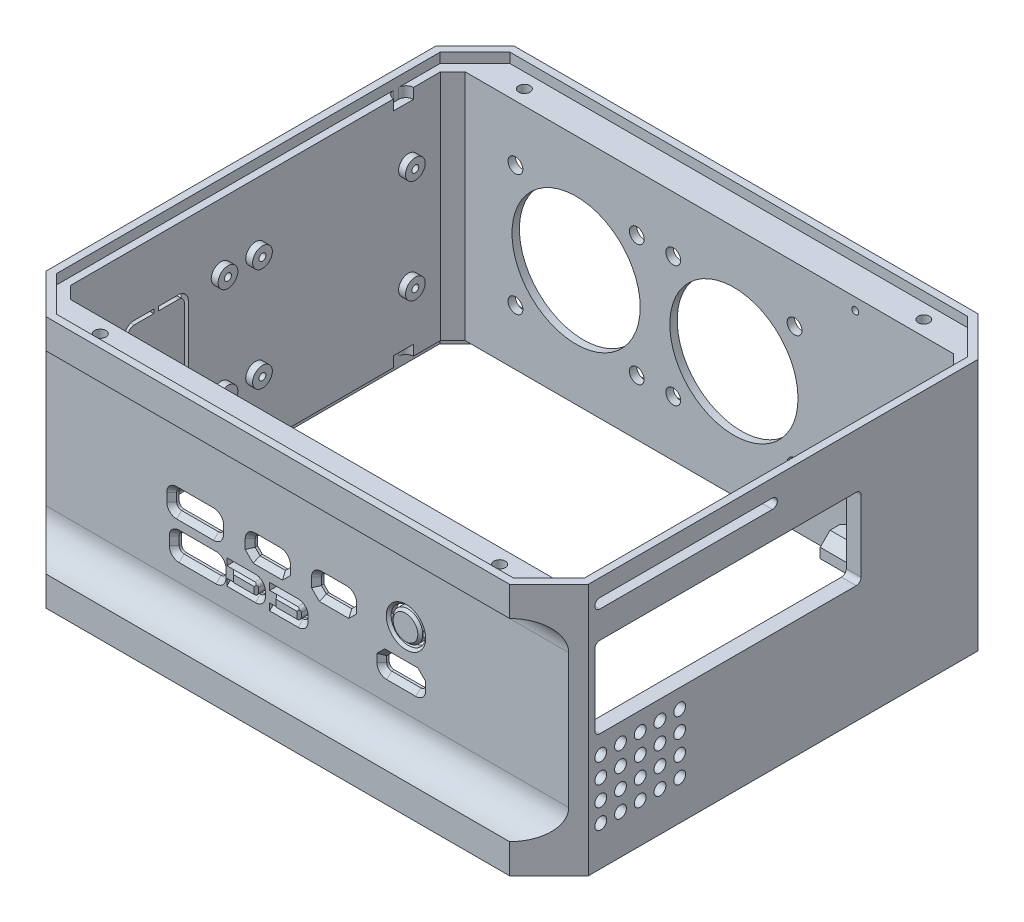
from build123d import *

# Parameters (mm, degrees)
SKETCH_1_W                = 110
SKETCH_1_H                = 95
EXTRUDE_1_DEPTH           = 47.2
CHAMFER_1_SIZE            = 8
CUT_EXTRUDE_1_DEPTH       = 95.258791408
EXTRUDE_2_DEPTH           = 2
EXTRUDE_3_DEPTH           = 2
SKETCH_5_W                = 6
SKETCH_5_H                = 39.2
CUT_EXTRUDE_2_DEPTH       = 130.823451574
SKETCH_7_W                = 6
SKETCH_7_H                = 39.2
CUT_EXTRUDE_3_DEPTH       = 130.823451574
FILLET_1_R                = 6
CUT_EXTRUDE_5_REACH       = 131.823
CUT_EXTRUDE_8_REACH       = 123.099
SKETCH_10_R               = 3.5
SKETCH_10_W               = 7.15
SKETCH_10_H               = 3.5
SKETCH_10_W_2             = 9.5
SKETCH_10_H_2             = 3.7
SKETCH_10_W_3             = 6.8
SKETCH_10_H_3             = 3
SKETCH_10_W_4             = 7.9
SKETCH_10_H_4             = 3.2
FILLET_2_R                = 1
CHAMFER_2_SIZE            = 1
SKETCH_15_W               = 6.4
SKETCH_15_H               = 2.2
EXTRUDE_4_DEPTH           = 2
SKETCH_17_W               = 5
SKETCH_17_H               = 2.2
EXTRUDE_5_DEPTH           = 0.5
EXTRUDE_5_DRAFT           = 39
EXTRUDE_5_PROFILE_2_DEPTH = 0.5
EXTRUDE_5_PROFILE_2_DRAFT = 39
FILLET_3_R                = 0.7
FILLET_4_R                = 1
CHAMFER_3_SIZE            = 1
SKETCH_18_R               = 1.15
CUT_EXTRUDE_9_DEPTH       = 3.5
CUT_EXTRUDE_START         = -3.5
SKETCH_19_R               = 1.15
CUT_EXTRUDE_10_DEPTH      = 3.5
SKETCH_20_R               = 13
SKETCH_20_R_2             = 1.5
CUT_EXTRUDE_11_DEPTH      = 121.001171574
SKETCH_22_W               = 62
SKETCH_22_H               = 39.2
CUT_EXTRUDE_12_DEPTH      = 122.099261679
EXTRUDE_6_DEPTH           = 3
EXTRUDE_6_DEPTH_BACK      = 3
CHAMFER_5_SIZE            = 2
CUT_EXTRUDE_15_REACH      = 131.823
SKETCH_26_R               = 1.2
SKETCH_27_W               = 13
SKETCH_27_H               = 22
CUT_EXTRUDE_16_DEPTH      = 10
FILLET_5_R                = 2
CHAMFER_6_SIZE            = 1.5
CUT_EXTRUDE_START_2       = -0.5
CUT_EXTRUDE_17_DEPTH      = 0.5
SKETCH_30_W               = 37
SKETCH_30_H               = 2
CUT_EXTRUDE_18_DEPTH      = 10
FILLET_6_R                = 1
SKETCH_31_R               = 2
EXTRUDE_7_DEPTH           = 1.4
SKETCH_32_R               = 0.7
CUT_EXTRUDE_19_DEPTH      = 3.5
SKETCH_39_R               = 3
EXTRUDE_12_DEPTH          = 1.6
CHAMFER_7_SIZE            = 0.5
SKETCH_40_W               = 10
SKETCH_40_H               = 1
EXTRUDE_13_DEPTH          = 1
CHAMFER_8_SIZE            = 0.5
EXTRUDE_14_DEPTH          = 1.2
SKETCH_42_W               = 1
SKETCH_42_H               = 24
EXTRUDE_15_DEPTH          = 1.2
SKETCH_43_R               = 2
EXTRUDE_16_DEPTH          = 1.4
SKETCH_44_R               = 0.7
CUT_EXTRUDE_20_DEPTH      = 3.5
SKETCH_45_W               = 1.5
SKETCH_45_H               = 4
CUT_EXTRUDE_21_DEPTH      = 2.1
FILLET_7_R                = 1.5
CUT_EXTRUDE_22_DEPTH      = 2.1
SKETCH_47_R               = 0.7
CUT_EXTRUDE_23_DEPTH      = 3


# Read off the part's stored shape, not the designer's step: 切除-拉伸17
# Some blends are built 0.0001 mm under size
with BuildPart() as part:
    # 草图1 → 凸台-拉伸1 (new body)
    with BuildSketch(Plane(origin=(0, 0, 0), x_dir=(1, 0, 0), z_dir=(0, 1, 0))):
        with Locations((10.752499413, 0.806196069)):
            Rectangle(SKETCH_1_W, SKETCH_1_H)
    extrude(amount=EXTRUDE_1_DEPTH)

    # 倒角1
    chamfer_1_edges = [part.edges().sort_by_distance(p)[0] for p in [
        (-44.247500587, 23.6, -48.306196069),
        (65.752499413, 23.6, -48.306196069),
        (65.752499413, 23.6, 46.693803931),
        (-44.247500587, 23.6, 46.693803931),
    ]]
    chamfer(chamfer_1_edges, length=CHAMFER_1_SIZE)

    # 草图2 → 切除-拉伸1 (cut, through all)
    with BuildSketch(Plane.XZ):
        Polygon((-38.747500587, 39.193803931), (60.252499413, 39.193803931), (62.752499413, 36.693803931), (62.752499413, -38.306196069), (60.252499413, -40.806196069), (-38.747500587, -40.806196069), (-41.247500587, -38.306196069), (-41.247500587, 36.693803931), align=None)
    extrude(amount=-CUT_EXTRUDE_1_DEPTH, mode=Mode.SUBTRACT)

    # 草图3 → 凸台-拉伸2 (add)
    with BuildSketch(Plane.XZ):
        Polygon((-44.247500587, -40.306196069), (-36.247500587, -48.306196069), (57.752499413, -48.306196069), (65.752499413, -40.306196069), (65.752499413, 38.693803931), (57.752499413, 46.693803931), (-36.247500587, 46.693803931), (-44.247500587, 38.693803931), align=None)
        Polygon((-42.747500587, -39.684875725), (-35.626180243, -46.806196069), (57.13117907, -46.806196069), (64.252499413, -39.684875725), (64.252499413, 38.072483588), (57.13117907, 45.193803931), (-35.626180243, 45.193803931), (-42.747500587, 38.072483588), align=None, mode=Mode.SUBTRACT)
    extrude(amount=EXTRUDE_2_DEPTH)

    # 草图4 → 凸台-拉伸3 (add)
    with BuildSketch(Plane(origin=(0, 47.2, 0), x_dir=(1, 0, 0), z_dir=(0, 1, 0))):
        Polygon((-36.247500587, 48.306196069), (-44.247500587, 40.306196069), (-44.247500587, -38.693803931), (-36.247500587, -46.693803931), (57.752499413, -46.693803931), (65.752499413, -38.693803931), (65.752499413, 40.306196069), (57.752499413, 48.306196069), align=None)
        Polygon((-35.626180243, 46.806196069), (-42.747500587, 39.684875725), (-42.747500587, -38.072483588), (-35.626180243, -45.193803931), (57.13117907, -45.193803931), (64.252499413, -38.072483588), (64.252499413, 39.684875725), (57.13117907, 46.806196069), align=None, mode=Mode.SUBTRACT)
    extrude(amount=EXTRUDE_3_DEPTH)

    # 草图5 → 切除-拉伸2 (cut, through all)
    with BuildSketch(Plane(origin=(65.752499413, 0, 0), x_dir=(0, 0, -1), z_dir=(1, 0, 0))):
        with Locations((-43.693803931, 23.6)):
            Rectangle(SKETCH_5_W, SKETCH_5_H)
    extrude(amount=-CUT_EXTRUDE_2_DEPTH, mode=Mode.SUBTRACT)

    # 草图7 → 切除-拉伸3 (cut, through all)
    with BuildSketch(Plane(origin=(65.752499413, 0, 0), x_dir=(0, 0, -1), z_dir=(1, 0, 0))):
        with Locations((45.306196069, 23.6)):
            Rectangle(SKETCH_7_W, SKETCH_7_H)
    extrude(amount=-CUT_EXTRUDE_3_DEPTH, mode=Mode.SUBTRACT)

    # 圆角1
    fillet_1_edges = [part.edges().sort_by_distance(p)[0] for p in [
        (10.752499413, 43.2, -42.306196069),
        (10.752499413, 4, -42.306196069),
        (10.752499413, 43.2, 40.693803931),
        (10.752499413, 4, 40.693803931),
    ]]
    fillet(fillet_1_edges, radius=FILLET_1_R - 0.0001)  # a hair under: the kernel refuses the full size

    # 草图9 → 切除-拉伸5 (cut, up to next)
    with BuildSketch(Plane(origin=(65.752499413, 0, 0), x_dir=(0, 0, -1), z_dir=(1, 0, 0)), mode=Mode.PRIVATE) as cut_extrude_5_sk1:
        with BuildLine():
            Line((15.606196069, 38.2), (-36.393803931, 38.2))
            ThreePointArc((-36.393803931, 38.2), (-37.100910712, 37.907106781), (-37.393803931, 37.2))
            Line((-37.393803931, 37.2), (-37.393803931, 22.8))
            ThreePointArc((-37.393803931, 22.8), (-37.100910712, 22.092893219), (-36.393803931, 21.8))
            Line((-36.393803931, 21.8), (15.606196069, 21.8))
            ThreePointArc((15.606196069, 21.8), (16.31330285, 22.092893219), (16.606196069, 22.8))
            Line((16.606196069, 22.8), (16.606196069, 37.2))
            ThreePointArc((16.606196069, 37.2), (16.31330285, 37.907106781), (15.606196069, 38.2))
        make_face()
    cut_extrude_5_tool1 = extrude(cut_extrude_5_sk1.sketch, amount=-CUT_EXTRUDE_5_REACH, mode=Mode.PRIVATE) & part.part
    add(cut_extrude_5_tool1.solids().sort_by_distance((65.752499, 30, 10.393804))[0], mode=Mode.SUBTRACT)

    # 草图10 → 切除-拉伸8 (cut, up to next)
    with BuildSketch(Plane.XY.offset(40.693803931), mode=Mode.PRIVATE) as cut_extrude_8_sk1:
        with Locations((30.752499413, 25.19)):
            Circle(SKETCH_10_R)
    cut_extrude_8_tool1 = extrude(cut_extrude_8_sk1.sketch, amount=-CUT_EXTRUDE_8_REACH, mode=Mode.PRIVATE) & part.part
    # 草图10 → 切除-拉伸8 (cut, up to next)
    with BuildSketch(Plane.XY.offset(40.693803931), mode=Mode.PRIVATE) as cut_extrude_8_sk2:
        with Locations((16.177499413, 23.66)):
            Rectangle(SKETCH_10_W, SKETCH_10_H)
    cut_extrude_8_tool2 = extrude(cut_extrude_8_sk2.sketch, amount=-CUT_EXTRUDE_8_REACH, mode=Mode.PRIVATE) & part.part
    # 草图10 → 切除-拉伸8 (cut, up to next)
    with BuildSketch(Plane.XY.offset(40.693803931), mode=Mode.PRIVATE) as cut_extrude_8_sk3:
        with Locations((2.727499413, 23.66)):
            Rectangle(SKETCH_10_W, SKETCH_10_H)
    cut_extrude_8_tool3 = extrude(cut_extrude_8_sk3.sketch, amount=-CUT_EXTRUDE_8_REACH, mode=Mode.PRIVATE) & part.part
    # 草图10 → 切除-拉伸8 (cut, up to next)
    with BuildSketch(Plane.XY.offset(40.693803931), mode=Mode.PRIVATE) as cut_extrude_8_sk4:
        with Locations((-11.997500587, 23.76)):
            Rectangle(SKETCH_10_W_2, SKETCH_10_H_2)
    cut_extrude_8_tool4 = extrude(cut_extrude_8_sk4.sketch, amount=-CUT_EXTRUDE_8_REACH, mode=Mode.PRIVATE) & part.part
    # 草图10 → 切除-拉伸8 (cut, up to next)
    with BuildSketch(Plane.XY.offset(40.693803931), mode=Mode.PRIVATE) as cut_extrude_8_sk5:
        with Locations((-11.497500587, 16.36)):
            Rectangle(SKETCH_10_W_2, SKETCH_10_H_2)
    cut_extrude_8_tool5 = extrude(cut_extrude_8_sk5.sketch, amount=-CUT_EXTRUDE_8_REACH, mode=Mode.PRIVATE) & part.part
    # 草图10 → 切除-拉伸8 (cut, up to next)
    with BuildSketch(Plane.XY.offset(40.693803931), mode=Mode.PRIVATE) as cut_extrude_8_sk6:
        with Locations((-2.159249242, 16.71)):
            Rectangle(SKETCH_10_W_3, SKETCH_10_H_3)
    cut_extrude_8_tool6 = extrude(cut_extrude_8_sk6.sketch, amount=-CUT_EXTRUDE_8_REACH, mode=Mode.PRIVATE) & part.part
    # 草图10 → 切除-拉伸8 (cut, up to next)
    with BuildSketch(Plane.XY.offset(40.693803931), mode=Mode.PRIVATE) as cut_extrude_8_sk7:
        with Locations((6.518865381, 16.71)):
            Rectangle(SKETCH_10_W_3, SKETCH_10_H_3)
    cut_extrude_8_tool7 = extrude(cut_extrude_8_sk7.sketch, amount=-CUT_EXTRUDE_8_REACH, mode=Mode.PRIVATE) & part.part
    # 草图10 → 切除-拉伸8 (cut, up to next)
    with BuildSketch(Plane.XY.offset(40.693803931), mode=Mode.PRIVATE) as cut_extrude_8_sk8:
        with Locations((29.802499413, 16.61)):
            Rectangle(SKETCH_10_W_4, SKETCH_10_H_4)
    cut_extrude_8_tool8 = extrude(cut_extrude_8_sk8.sketch, amount=-CUT_EXTRUDE_8_REACH, mode=Mode.PRIVATE) & part.part
    add(cut_extrude_8_tool1.solids().sort_by_distance((30.752499, 25.19, 40.693804))[0], mode=Mode.SUBTRACT)
    add(cut_extrude_8_tool2.solids().sort_by_distance((16.177499, 23.66, 40.693804))[0], mode=Mode.SUBTRACT)
    add(cut_extrude_8_tool3.solids().sort_by_distance((2.727499, 23.66, 40.693804))[0], mode=Mode.SUBTRACT)
    add(cut_extrude_8_tool4.solids().sort_by_distance((-11.997501, 23.76, 40.693804))[0], mode=Mode.SUBTRACT)
    add(cut_extrude_8_tool5.solids().sort_by_distance((-11.497501, 16.36, 40.693804))[0], mode=Mode.SUBTRACT)
    add(cut_extrude_8_tool6.solids().sort_by_distance((-2.159249, 16.71, 40.693804))[0], mode=Mode.SUBTRACT)
    add(cut_extrude_8_tool7.solids().sort_by_distance((6.518865, 16.71, 40.693804))[0], mode=Mode.SUBTRACT)
    add(cut_extrude_8_tool8.solids().sort_by_distance((29.802499, 16.61, 40.693804))[0], mode=Mode.SUBTRACT)

    # 圆角2
    fillet_2_edges = [part.edges().sort_by_distance(p)[0] for p in [
        (12.602499413, 25.41, 39.943803931),
        (19.752499413, 25.41, 39.943803931),
        (-0.847500587, 25.41, 39.943803931),
        (6.302499413, 25.41, 39.943803931),
        (-16.747500587, 21.91, 39.943803931),
        (-16.747500587, 25.61, 39.943803931),
        (-7.247500587, 25.61, 39.943803931),
        (-7.247500587, 21.91, 39.943803931),
        (-16.247500587, 14.51, 39.943803931),
        (-16.247500587, 18.21, 39.943803931),
        (-6.747500587, 18.21, 39.943803931),
        (-6.747500587, 14.51, 39.943803931),
        (25.852499413, 15.01, 39.943803931),
        (33.752499413, 15.01, 39.943803931),
    ]]
    fillet(fillet_2_edges, radius=FILLET_2_R)

    # 倒角2
    chamfer_2_edges = [part.edges().sort_by_distance(p)[0] for p in [
        (12.602499413, 21.91, 39.943803931),
        (19.752499413, 21.91, 39.943803931),
        (-0.847500587, 21.91, 39.943803931),
        (6.302499413, 21.91, 39.943803931),
        (25.852499413, 18.21, 39.943803931),
        (33.752499413, 18.21, 39.943803931),
    ]]
    chamfer(chamfer_2_edges, length=CHAMFER_2_SIZE)

    # 草图15 → 凸台-拉伸4 (add)
    with BuildSketch(Plane.XY.offset(40.693803931)):
        with Locations((-2.359249242, 16.71)):
            Rectangle(SKETCH_15_W, SKETCH_15_H)
        with Locations((6.318865381, 16.71)):
            Rectangle(SKETCH_15_W, SKETCH_15_H)
    extrude(amount=-EXTRUDE_4_DEPTH)


with BuildPart() as extrude_5_tool:
    # 草图17 → 凸台-拉伸5 (with draft: the straight prism first)
    with BuildSketch(Plane.XY.offset(40.693803931)):
        with Locations((-1.659249242, 16.71)):
            Rectangle(SKETCH_17_W, SKETCH_17_H)
    extrude(amount=EXTRUDE_5_DEPTH)
    # 凸台-拉伸5: the draft: its side faces are tilted about the plane it starts from
    extrude_5_sides = [extrude_5_tool.faces().sort_by_distance(p)[0] for p in [
        (-1.659249242, 17.81, 40.943803931),
        (-4.159249242, 16.71, 40.943803931),
        (-1.659249242, 15.61, 40.943803931),
        (0.840750758, 16.71, 40.943803931),
    ]]
    draft(extrude_5_sides, Plane.XY.offset(40.693803931), EXTRUDE_5_DRAFT)


with BuildPart() as part_1:
    add(part.part)

    # 凸台-拉伸5: add extrude_5_tool
    add(extrude_5_tool.part)


with BuildPart() as extrude_5_profile_2_tool:
    # 草图17 → 凸台-拉伸5 profile 2 (with draft: the straight prism first)
    with BuildSketch(Plane.XY.offset(40.693803931)):
        with Locations((7.018865381, 16.71)):
            Rectangle(SKETCH_17_W, SKETCH_17_H)
    extrude(amount=EXTRUDE_5_PROFILE_2_DEPTH)
    # 凸台-拉伸5 profile 2: the draft: its side faces are tilted about the plane it starts from
    extrude_5_profile_2_sides = [extrude_5_profile_2_tool.faces().sort_by_distance(p)[0] for p in [
        (7.018865381, 17.81, 40.943803931),
        (4.518865381, 16.71, 40.943803931),
        (7.018865381, 15.61, 40.943803931),
        (9.518865381, 16.71, 40.943803931),
    ]]
    draft(extrude_5_profile_2_sides, Plane.XY.offset(40.693803931), EXTRUDE_5_PROFILE_2_DRAFT)


with BuildPart() as part_2:
    add(part_1.part)

    # 凸台-拉伸5 profile 2: add extrude_5_profile_2_tool
    add(extrude_5_profile_2_tool.part)

    # 圆角3
    fillet_3_edges = [part_2.edges().sort_by_distance(p)[0] for p in [
        (0.840750758, 17.81, 39.693803931),
        (0.840750758, 15.61, 39.693803931),
        (9.518865381, 17.81, 39.693803931),
        (9.518865381, 15.61, 39.693803931),
    ]]
    fillet(fillet_3_edges, radius=FILLET_3_R)

    # 圆角4
    fillet_4_edges = [part_2.edges().sort_by_distance(p)[0] for p in [
        (1.240750758, 18.21, 39.943803931),
        (1.240750758, 15.21, 39.943803931),
        (9.918865381, 18.21, 39.943803931),
        (9.918865381, 15.21, 39.943803931),
    ]]
    fillet(fillet_4_edges, radius=FILLET_4_R)

    # 倒角3
    chamfer_3_edges = [part_2.edges().sort_by_distance(p)[0] for p in [
        (-2.659249242, 15.21, 40.693803931),
        (6.018865381, 15.21, 40.693803931),
        (-0.847500587, 23.66, 40.693803931),
        (2.727499413, 25.41, 40.693803931),
        (16.177499413, 25.41, 40.693803931),
        (12.602499413, 23.66, 40.693803931),
        (33.752499413, 16.61, 40.693803931),
        (29.802499413, 15.01, 40.693803931),
        (-6.747500587, 16.36, 40.693803931),
        (-11.497500587, 14.51, 40.693803931),
        (-11.497500587, 18.21, 40.693803931),
        (-16.247500587, 16.36, 40.693803931),
        (-11.997500587, 21.91, 40.693803931),
        (-16.747500587, 23.76, 40.693803931),
        (-11.997500587, 25.61, 40.693803931),
        (-7.247500587, 23.76, 40.693803931),
        (-0.554607368, 25.117106781, 40.693803931),
        (6.009606195, 25.117106781, 40.693803931),
        (19.459606195, 25.117106781, 40.693803931),
        (12.895392632, 25.117106781, 40.693803931),
        (33.459606195, 15.302893219, 40.693803931),
        (26.145392632, 15.302893219, 40.693803931),
        (-7.040393805, 14.802893219, 40.693803931),
        (-7.040393805, 17.917106781, 40.693803931),
        (-15.954607368, 17.917106781, 40.693803931),
        (-15.954607368, 14.802893219, 40.693803931),
        (-16.454607368, 22.202893219, 40.693803931),
        (-16.454607368, 25.317106781, 40.693803931),
        (-7.540393805, 25.317106781, 40.693803931),
        (-7.540393805, 22.202893219, 40.693803931),
        (29.802499413, 18.21, 40.693803931),
        (25.852499413, 16.61, 40.693803931),
        (16.177499413, 21.91, 40.693803931),
        (19.752499413, 23.66, 40.693803931),
        (6.302499413, 23.66, 40.693803931),
        (2.727499413, 21.91, 40.693803931),
        (33.252499413, 17.71, 40.693803931),
        (26.352499413, 17.71, 40.693803931),
        (13.102499413, 22.41, 40.693803931),
        (19.252499413, 22.41, 40.693803931),
        (5.802499413, 22.41, 40.693803931),
        (-0.347500587, 22.41, 40.693803931),
        (1.240750758, 16.71, 40.693803931),
        (-2.659249242, 18.21, 40.693803931),
        (9.918865381, 16.71, 40.693803931),
        (6.018865381, 18.21, 40.693803931),
        (0.94785754, 15.502893219, 40.693803931),
        (0.94785754, 17.917106781, 40.693803931),
        (9.625972162, 15.502893219, 40.693803931),
        (9.625972162, 17.917106781, 40.693803931),
    ]]
    chamfer(chamfer_3_edges, length=CHAMFER_3_SIZE)

    # 草图18 → 切除-拉伸9 (cut)
    with BuildSketch(Plane(origin=(0, 47.2, 0), x_dir=(1, 0, 0), z_dir=(0, 1, 0))):
        with Locations(Location((-29.747500587, 43.806196069, 0), (0, 0, 270))):
            Circle(SKETCH_18_R)
        with Locations(Location((51.252499413, 43.806196069, 0), (0, 0, 270))):
            Circle(SKETCH_18_R)
        with Locations(Location((-29.747500587, -42.193803931, 0), (0, 0, 270))):
            Circle(SKETCH_18_R)
        with Locations(Location((51.252499413, -42.193803931, 0), (0, 0, 270))):
            Circle(SKETCH_18_R)
    extrude(amount=-CUT_EXTRUDE_9_DEPTH, mode=Mode.SUBTRACT)

    # 草图19 → 切除-拉伸10 (cut)
    with BuildSketch(Plane.XZ.offset(CUT_EXTRUDE_START)):
        with Locations(Location((51.252499413, 42.193803931, 0), (0, 0, 90))):
            Circle(SKETCH_19_R)
        with Locations(Location((-29.747500587, 42.193803931, 0), (0, 0, 90))):
            Circle(SKETCH_19_R)
        with Locations(Location((51.252499413, -43.806196069, 0), (0, 0, 90))):
            Circle(SKETCH_19_R)
        with Locations(Location((-29.747500587, -43.806196069, 0), (0, 0, 90))):
            Circle(SKETCH_19_R)
    extrude(amount=CUT_EXTRUDE_10_DEPTH, mode=Mode.SUBTRACT)

    # 草图20 → 切除-拉伸11 (cut, through all)
    with BuildSketch(Plane.XY.offset(-40.806196069)):
        with Locations((-16.247500587, 23.6)):
            Circle(SKETCH_20_R)
        with Locations((15.752499413, 23.6)):
            Circle(SKETCH_20_R)
        with Locations((28.052499413, 35.9)):
            Circle(SKETCH_20_R_2)
        with Locations((3.452499413, 35.9)):
            Circle(SKETCH_20_R_2)
        with Locations((-3.947500587, 35.9)):
            Circle(SKETCH_20_R_2)
        with Locations((-28.547500587, 35.9)):
            Circle(SKETCH_20_R_2)
        with Locations((28.052499413, 11.3)):
            Circle(SKETCH_20_R_2)
        with Locations((3.452499413, 11.3)):
            Circle(SKETCH_20_R_2)
        with Locations((-3.947500587, 11.3)):
            Circle(SKETCH_20_R_2)
        with Locations((-28.547500587, 11.3)):
            Circle(SKETCH_20_R_2)
    extrude(amount=-CUT_EXTRUDE_11_DEPTH, mode=Mode.SUBTRACT)

    # 草图22 → 切除-拉伸12 (cut, through all)
    with BuildSketch(Plane(origin=(0, 0, -42.306196069), x_dir=(-1, 0, 0), z_dir=(0, 0, -1))):
        with Locations((0.247500587, 23.6)):
            Rectangle(SKETCH_22_W, SKETCH_22_H)
    extrude(amount=CUT_EXTRUDE_12_DEPTH, mode=Mode.SUBTRACT)

    # 草图24 → 凸台-拉伸6 (add, two sides: drawn at the far end of the back side and taken through both)
    with BuildSketch(Plane(origin=(0, 22.2, 0), x_dir=(-1, 0, 0), z_dir=(0, -1, 0)).offset(-EXTRUDE_6_DEPTH_BACK)):
        Polygon((-62.752499413, 17.306196069), (-56.752499413, 17.306196069), (-56.752499413, 21.306196069), (-62.752499413, 27.306196069), align=None)
    extrude(amount=EXTRUDE_6_DEPTH + EXTRUDE_6_DEPTH_BACK)

    # 倒角5
    chamfer_5_edges = [part_2.edges().sort_by_distance(p)[0] for p in [
        (59.752499413, 25.2, -17.306196069),
        (59.752499413, 19.2, -17.306196069),
    ]]
    chamfer(chamfer_5_edges, length=CHAMFER_5_SIZE)

    # 草图26 → 切除-拉伸15 (cut, up to next)
    with BuildSketch(Plane(origin=(65.752499413, 0, 0), x_dir=(0, 0, -1), z_dir=(1, 0, 0)), mode=Mode.PRIVATE) as cut_extrude_15_sk1:
        with Locations((-36.193803931, 6)):
            Circle(SKETCH_26_R)
    cut_extrude_15_tool1 = extrude(cut_extrude_15_sk1.sketch, amount=-CUT_EXTRUDE_15_REACH, mode=Mode.PRIVATE) & part_2.part
    # 草图26 → 切除-拉伸15 (cut, up to next)
    with BuildSketch(Plane(origin=(65.752499413, 0, 0), x_dir=(0, 0, -1), z_dir=(1, 0, 0)), mode=Mode.PRIVATE) as cut_extrude_15_sk2:
        with Locations((-32.193803931, 6)):
            Circle(SKETCH_26_R)
    cut_extrude_15_tool2 = extrude(cut_extrude_15_sk2.sketch, amount=-CUT_EXTRUDE_15_REACH, mode=Mode.PRIVATE) & part_2.part
    # 草图26 → 切除-拉伸15 (cut, up to next)
    with BuildSketch(Plane(origin=(65.752499413, 0, 0), x_dir=(0, 0, -1), z_dir=(1, 0, 0)), mode=Mode.PRIVATE) as cut_extrude_15_sk3:
        with Locations((-28.193803931, 6)):
            Circle(SKETCH_26_R)
    cut_extrude_15_tool3 = extrude(cut_extrude_15_sk3.sketch, amount=-CUT_EXTRUDE_15_REACH, mode=Mode.PRIVATE) & part_2.part
    # 草图26 → 切除-拉伸15 (cut, up to next)
    with BuildSketch(Plane(origin=(65.752499413, 0, 0), x_dir=(0, 0, -1), z_dir=(1, 0, 0)), mode=Mode.PRIVATE) as cut_extrude_15_sk4:
        with Locations((-24.193803931, 6)):
            Circle(SKETCH_26_R)
    cut_extrude_15_tool4 = extrude(cut_extrude_15_sk4.sketch, amount=-CUT_EXTRUDE_15_REACH, mode=Mode.PRIVATE) & part_2.part
    # 草图26 → 切除-拉伸15 (cut, up to next)
    with BuildSketch(Plane(origin=(65.752499413, 0, 0), x_dir=(0, 0, -1), z_dir=(1, 0, 0)), mode=Mode.PRIVATE) as cut_extrude_15_sk5:
        with Locations((-20.193803931, 6)):
            Circle(SKETCH_26_R)
    cut_extrude_15_tool5 = extrude(cut_extrude_15_sk5.sketch, amount=-CUT_EXTRUDE_15_REACH, mode=Mode.PRIVATE) & part_2.part
    # 草图26 → 切除-拉伸15 (cut, up to next)
    with BuildSketch(Plane(origin=(65.752499413, 0, 0), x_dir=(0, 0, -1), z_dir=(1, 0, 0)), mode=Mode.PRIVATE) as cut_extrude_15_sk6:
        with Locations((-32.193803931, 10)):
            Circle(SKETCH_26_R)
    cut_extrude_15_tool6 = extrude(cut_extrude_15_sk6.sketch, amount=-CUT_EXTRUDE_15_REACH, mode=Mode.PRIVATE) & part_2.part
    # 草图26 → 切除-拉伸15 (cut, up to next)
    with BuildSketch(Plane(origin=(65.752499413, 0, 0), x_dir=(0, 0, -1), z_dir=(1, 0, 0)), mode=Mode.PRIVATE) as cut_extrude_15_sk7:
        with Locations((-28.193803931, 10)):
            Circle(SKETCH_26_R)
    cut_extrude_15_tool7 = extrude(cut_extrude_15_sk7.sketch, amount=-CUT_EXTRUDE_15_REACH, mode=Mode.PRIVATE) & part_2.part
    # 草图26 → 切除-拉伸15 (cut, up to next)
    with BuildSketch(Plane(origin=(65.752499413, 0, 0), x_dir=(0, 0, -1), z_dir=(1, 0, 0)), mode=Mode.PRIVATE) as cut_extrude_15_sk8:
        with Locations((-24.193803931, 10)):
            Circle(SKETCH_26_R)
    cut_extrude_15_tool8 = extrude(cut_extrude_15_sk8.sketch, amount=-CUT_EXTRUDE_15_REACH, mode=Mode.PRIVATE) & part_2.part
    # 草图26 → 切除-拉伸15 (cut, up to next)
    with BuildSketch(Plane(origin=(65.752499413, 0, 0), x_dir=(0, 0, -1), z_dir=(1, 0, 0)), mode=Mode.PRIVATE) as cut_extrude_15_sk9:
        with Locations((-20.193803931, 10)):
            Circle(SKETCH_26_R)
    cut_extrude_15_tool9 = extrude(cut_extrude_15_sk9.sketch, amount=-CUT_EXTRUDE_15_REACH, mode=Mode.PRIVATE) & part_2.part
    # 草图26 → 切除-拉伸15 (cut, up to next)
    with BuildSketch(Plane(origin=(65.752499413, 0, 0), x_dir=(0, 0, -1), z_dir=(1, 0, 0)), mode=Mode.PRIVATE) as cut_extrude_15_sk10:
        with Locations((-32.193803931, 14)):
            Circle(SKETCH_26_R)
    cut_extrude_15_tool10 = extrude(cut_extrude_15_sk10.sketch, amount=-CUT_EXTRUDE_15_REACH, mode=Mode.PRIVATE) & part_2.part
    # 草图26 → 切除-拉伸15 (cut, up to next)
    with BuildSketch(Plane(origin=(65.752499413, 0, 0), x_dir=(0, 0, -1), z_dir=(1, 0, 0)), mode=Mode.PRIVATE) as cut_extrude_15_sk11:
        with Locations((-28.193803931, 14)):
            Circle(SKETCH_26_R)
    cut_extrude_15_tool11 = extrude(cut_extrude_15_sk11.sketch, amount=-CUT_EXTRUDE_15_REACH, mode=Mode.PRIVATE) & part_2.part
    # 草图26 → 切除-拉伸15 (cut, up to next)
    with BuildSketch(Plane(origin=(65.752499413, 0, 0), x_dir=(0, 0, -1), z_dir=(1, 0, 0)), mode=Mode.PRIVATE) as cut_extrude_15_sk12:
        with Locations((-24.193803931, 14)):
            Circle(SKETCH_26_R)
    cut_extrude_15_tool12 = extrude(cut_extrude_15_sk12.sketch, amount=-CUT_EXTRUDE_15_REACH, mode=Mode.PRIVATE) & part_2.part
    # 草图26 → 切除-拉伸15 (cut, up to next)
    with BuildSketch(Plane(origin=(65.752499413, 0, 0), x_dir=(0, 0, -1), z_dir=(1, 0, 0)), mode=Mode.PRIVATE) as cut_extrude_15_sk13:
        with Locations((-20.193803931, 14)):
            Circle(SKETCH_26_R)
    cut_extrude_15_tool13 = extrude(cut_extrude_15_sk13.sketch, amount=-CUT_EXTRUDE_15_REACH, mode=Mode.PRIVATE) & part_2.part
    # 草图26 → 切除-拉伸15 (cut, up to next)
    with BuildSketch(Plane(origin=(65.752499413, 0, 0), x_dir=(0, 0, -1), z_dir=(1, 0, 0)), mode=Mode.PRIVATE) as cut_extrude_15_sk14:
        with Locations((-32.193803931, 18)):
            Circle(SKETCH_26_R)
    cut_extrude_15_tool14 = extrude(cut_extrude_15_sk14.sketch, amount=-CUT_EXTRUDE_15_REACH, mode=Mode.PRIVATE) & part_2.part
    # 草图26 → 切除-拉伸15 (cut, up to next)
    with BuildSketch(Plane(origin=(65.752499413, 0, 0), x_dir=(0, 0, -1), z_dir=(1, 0, 0)), mode=Mode.PRIVATE) as cut_extrude_15_sk15:
        with Locations((-28.193803931, 18)):
            Circle(SKETCH_26_R)
    cut_extrude_15_tool15 = extrude(cut_extrude_15_sk15.sketch, amount=-CUT_EXTRUDE_15_REACH, mode=Mode.PRIVATE) & part_2.part
    # 草图26 → 切除-拉伸15 (cut, up to next)
    with BuildSketch(Plane(origin=(65.752499413, 0, 0), x_dir=(0, 0, -1), z_dir=(1, 0, 0)), mode=Mode.PRIVATE) as cut_extrude_15_sk16:
        with Locations((-24.193803931, 18)):
            Circle(SKETCH_26_R)
    cut_extrude_15_tool16 = extrude(cut_extrude_15_sk16.sketch, amount=-CUT_EXTRUDE_15_REACH, mode=Mode.PRIVATE) & part_2.part
    # 草图26 → 切除-拉伸15 (cut, up to next)
    with BuildSketch(Plane(origin=(65.752499413, 0, 0), x_dir=(0, 0, -1), z_dir=(1, 0, 0)), mode=Mode.PRIVATE) as cut_extrude_15_sk17:
        with Locations((-20.193803931, 18)):
            Circle(SKETCH_26_R)
    cut_extrude_15_tool17 = extrude(cut_extrude_15_sk17.sketch, amount=-CUT_EXTRUDE_15_REACH, mode=Mode.PRIVATE) & part_2.part
    # 草图26 → 切除-拉伸15 (cut, up to next)
    with BuildSketch(Plane(origin=(65.752499413, 0, 0), x_dir=(0, 0, -1), z_dir=(1, 0, 0)), mode=Mode.PRIVATE) as cut_extrude_15_sk18:
        with Locations((-36.193803931, 10)):
            Circle(SKETCH_26_R)
    cut_extrude_15_tool18 = extrude(cut_extrude_15_sk18.sketch, amount=-CUT_EXTRUDE_15_REACH, mode=Mode.PRIVATE) & part_2.part
    # 草图26 → 切除-拉伸15 (cut, up to next)
    with BuildSketch(Plane(origin=(65.752499413, 0, 0), x_dir=(0, 0, -1), z_dir=(1, 0, 0)), mode=Mode.PRIVATE) as cut_extrude_15_sk19:
        with Locations((-36.193803931, 14)):
            Circle(SKETCH_26_R)
    cut_extrude_15_tool19 = extrude(cut_extrude_15_sk19.sketch, amount=-CUT_EXTRUDE_15_REACH, mode=Mode.PRIVATE) & part_2.part
    # 草图26 → 切除-拉伸15 (cut, up to next)
    with BuildSketch(Plane(origin=(65.752499413, 0, 0), x_dir=(0, 0, -1), z_dir=(1, 0, 0)), mode=Mode.PRIVATE) as cut_extrude_15_sk20:
        with Locations((-36.193803931, 18)):
            Circle(SKETCH_26_R)
    cut_extrude_15_tool20 = extrude(cut_extrude_15_sk20.sketch, amount=-CUT_EXTRUDE_15_REACH, mode=Mode.PRIVATE) & part_2.part
    add(cut_extrude_15_tool1.solids().sort_by_distance((65.752499, 6, 36.193804))[0], mode=Mode.SUBTRACT)
    add(cut_extrude_15_tool2.solids().sort_by_distance((65.752499, 6, 32.193804))[0], mode=Mode.SUBTRACT)
    add(cut_extrude_15_tool3.solids().sort_by_distance((65.752499, 6, 28.193804))[0], mode=Mode.SUBTRACT)
    add(cut_extrude_15_tool4.solids().sort_by_distance((65.752499, 6, 24.193804))[0], mode=Mode.SUBTRACT)
    add(cut_extrude_15_tool5.solids().sort_by_distance((65.752499, 6, 20.193804))[0], mode=Mode.SUBTRACT)
    add(cut_extrude_15_tool6.solids().sort_by_distance((65.752499, 10, 32.193804))[0], mode=Mode.SUBTRACT)
    add(cut_extrude_15_tool7.solids().sort_by_distance((65.752499, 10, 28.193804))[0], mode=Mode.SUBTRACT)
    add(cut_extrude_15_tool8.solids().sort_by_distance((65.752499, 10, 24.193804))[0], mode=Mode.SUBTRACT)
    add(cut_extrude_15_tool9.solids().sort_by_distance((65.752499, 10, 20.193804))[0], mode=Mode.SUBTRACT)
    add(cut_extrude_15_tool10.solids().sort_by_distance((65.752499, 14, 32.193804))[0], mode=Mode.SUBTRACT)
    add(cut_extrude_15_tool11.solids().sort_by_distance((65.752499, 14, 28.193804))[0], mode=Mode.SUBTRACT)
    add(cut_extrude_15_tool12.solids().sort_by_distance((65.752499, 14, 24.193804))[0], mode=Mode.SUBTRACT)
    add(cut_extrude_15_tool13.solids().sort_by_distance((65.752499, 14, 20.193804))[0], mode=Mode.SUBTRACT)
    add(cut_extrude_15_tool14.solids().sort_by_distance((65.752499, 18, 32.193804))[0], mode=Mode.SUBTRACT)
    add(cut_extrude_15_tool15.solids().sort_by_distance((65.752499, 18, 28.193804))[0], mode=Mode.SUBTRACT)
    add(cut_extrude_15_tool16.solids().sort_by_distance((65.752499, 18, 24.193804))[0], mode=Mode.SUBTRACT)
    add(cut_extrude_15_tool17.solids().sort_by_distance((65.752499, 18, 20.193804))[0], mode=Mode.SUBTRACT)
    add(cut_extrude_15_tool18.solids().sort_by_distance((65.752499, 10, 36.193804))[0], mode=Mode.SUBTRACT)
    add(cut_extrude_15_tool19.solids().sort_by_distance((65.752499, 14, 36.193804))[0], mode=Mode.SUBTRACT)
    add(cut_extrude_15_tool20.solids().sort_by_distance((65.752499, 18, 36.193804))[0], mode=Mode.SUBTRACT)

    # 草图27 → 切除-拉伸16 (cut)
    with BuildSketch(Plane.ZY.offset(44.247500587)):
        with Locations((19.330426204, 23.6)):
            Rectangle(SKETCH_27_W, SKETCH_27_H)
    extrude(amount=-CUT_EXTRUDE_16_DEPTH, mode=Mode.SUBTRACT)

    # 圆角5
    fillet_5_edges = [part_2.edges().sort_by_distance(p)[0] for p in [
        (-42.747500587, 12.6, 25.830426204),
        (-42.747500587, 12.6, 12.830426204),
        (-42.747500587, 34.6, 12.830426204),
        (-42.747500587, 34.6, 25.830426204),
    ]]
    fillet(fillet_5_edges, radius=FILLET_5_R)

    # 倒角6
    chamfer_6_edges = [part_2.edges().sort_by_distance(p)[0] for p in [
        (-44.247500587, 23.6, 12.830426204),
        (-44.247500587, 34.6, 19.330426204),
        (-44.247500587, 23.6, 25.830426204),
        (-44.247500587, 12.6, 19.330426204),
        (-44.247500587, 34.014213562, 13.416212642),
        (-44.247500587, 34.014213562, 25.244639766),
        (-44.247500587, 13.185786438, 25.244639766),
        (-44.247500587, 13.185786438, 13.416212642),
    ]]
    chamfer(chamfer_6_edges, length=CHAMFER_6_SIZE)

    # 切除-拉伸17 outline → 切除-拉伸17 (cut)
    with BuildSketch(Plane.ZY.offset(44.247500587).offset(CUT_EXTRUDE_START_2)):
        with BuildLine():
            Line((-10.255813886, 22.792180209), (-9.920722215, 23.366581335))
            add(Edge.make_bspline(
                [(-9.920722215, 23.366581335), (-9.817027132, 23.554104117), (-9.761174462, 23.761494283), (-9.761174462, 24.176372004), (-9.817027132, 24.383810865), (-9.920722215, 24.571284952)],
                knots=[3, 3, 3, 3, 4, 4, 5, 5, 5, 5], degree=3))
            Line((-9.920722215, 24.571284952), (-10.255813886, 25.145734773))
            Line((-10.255813886, 25.145734773), (-11.975097352, 28.125550179))
            Line((-11.975097352, 28.125550179), (-12.306196069, 28.7))
            add(Edge.make_bspline(
                [(-12.306196069, 28.7), (-12.521596491, 29.07095522), (-12.920502394, 29.302351809), (-13.347334631, 29.302351809)],
                knots=[8, 8, 8, 8, 9, 9, 9, 9], degree=3))
            Line((-13.347334631, 29.302351809), (-18.118257992, 29.302351809))
            add(Edge.make_bspline(
                [(-18.118257992, 29.302351809), (-18.549058836, 29.302351809), (-18.943996132, 29.07095522), (-19.159396554, 28.7)],
                knots=[10, 10, 10, 10, 11, 11, 11, 11], degree=3))
            Line((-19.159396554, 28.7), (-19.49049527, 28.125550179))
            Line((-19.49049527, 28.125550179), (-21.209778737, 25.145734773))
            Line((-21.209778737, 25.145734773), (-21.544846061, 24.571284952))
            add(Edge.make_bspline(
                [(-21.544846061, 24.571284952), (-21.652558445, 24.383810865), (-21.704418161, 24.176372004), (-21.704418161, 23.761494283), (-21.652558445, 23.554104117), (-21.544846061, 23.366581335)],
                knots=[14, 14, 14, 14, 15, 15, 16, 16, 16, 16], degree=3))
            Line((-21.544846061, 23.366581335), (-21.209778737, 22.792180209))
            Line((-21.209778737, 22.792180209), (-19.49049527, 19.812364803))
            Line((-19.49049527, 19.812364803), (-19.159396554, 19.237963677))
            add(Edge.make_bspline(
                [(-19.159396554, 19.237963677), (-18.943996132, 18.862966807), (-18.549058836, 18.635611868), (-18.118257992, 18.635611868)],
                knots=[19, 19, 19, 19, 20, 20, 20, 20], degree=3))
            Line((-18.118257992, 18.635611868), (-13.347334631, 18.635611868))
            add(Edge.make_bspline(
                [(-13.347334631, 18.635611868), (-12.920502394, 18.635611868), (-12.521596491, 18.862966807), (-12.306196069, 19.237963677)],
                knots=[21, 21, 21, 21, 22, 22, 22, 22], degree=3))
            Line((-12.306196069, 19.237963677), (-11.975097352, 19.812364803))
            Line((-11.975097352, 19.812364803), (-10.255813886, 22.792180209))
        make_face()
        with BuildLine():
            add(Edge.make_bspline(
                [(-18.768476561, 19.740589009), (-18.756497697, 19.716631282), (-18.728571362, 19.700659464), (-18.700645027, 19.700659464)],
                knots=[0, 0, 0, 0, 1, 1, 1, 1], degree=3))
            Line((-18.768476561, 19.740589009), (-19.20327036, 20.506457178))
            add(Edge.make_bspline(
                [(-19.135463174, 20.622155472), (-19.195284451, 20.622155472), (-19.231196695, 20.558316893), (-19.20327036, 20.506457178)],
                knots=[2, 2, 2, 2, 3, 3, 3, 3], degree=3))
            Line((-19.135463174, 20.622155472), (-17.376274509, 20.622155472))
            add(Edge.make_bspline(
                [(-17.308467323, 20.582225926), (-17.324414794, 20.606183654), (-17.348372521, 20.622155472), (-17.376274509, 20.622155472)],
                knots=[4, 4, 4, 4, 5, 5, 5, 5], degree=3))
            Line((-17.308467323, 20.582225926), (-16.877642131, 19.816357758))
            add(Edge.make_bspline(
                [(-16.945473664, 19.700659464), (-16.88562804, 19.700659464), (-16.849740143, 19.764498042), (-16.877642131, 19.816357758)],
                knots=[6, 6, 6, 6, 7, 7, 7, 7], degree=3))
            Line((-16.945473664, 19.700659464), (-18.700645027, 19.700659464))
        make_face(mode=Mode.SUBTRACT)
        with BuildLine():
            add(Edge.make_bspline(
                [(-15.708850758, 20.159410991), (-15.884370329, 20.470520587), (-16.203490181, 20.689938311), (-16.486722137, 20.689938311), (-16.761968184, 20.689938311), (-16.837761279, 20.470520587), (-16.658248754, 20.159410991)],
                knots=[0, 0, 0, 0, 1, 1, 1, 2, 2, 2, 2], degree=3))
            add(Edge.make_bspline(
                [(-16.658248754, 20.159410991), (-16.486722137, 19.852245654), (-16.16360933, 19.632876625), (-15.888363283, 19.632876625), (-15.609124282, 19.632876625), (-15.533331186, 19.852245654), (-15.708850758, 20.159410991)],
                knots=[2, 2, 2, 2, 3, 3, 3, 4, 4, 4, 4], degree=3))
        make_face(mode=Mode.SUBTRACT)
        with BuildLine():
            add(Edge.make_bspline(
                [(-18.305732079, 22.520951464), (-18.050426458, 22.066144197), (-17.715359134, 21.850768122), (-16.945473664, 21.850768122), (-16.949466619, 22.098087834), (-17.204747892, 22.544860497)],
                knots=[0, 0, 0, 0, 1, 1, 2.031545133, 2.031545133, 2.031545133, 2.031545133], degree=3))
            Line((-17.204747892, 22.544860497), (-17.396239282, 22.88791373))
            add(Edge.make_bspline(
                [(-17.464046468, 22.927843276), (-17.436120133, 22.927843276), (-17.408193798, 22.911871457), (-17.396239282, 22.88791373)],
                knots=[4, 4, 4, 4, 5, 5, 5, 5], degree=3))
            Line((-17.464046468, 22.927843276), (-20.511693407, 22.927843276))
            add(Edge.make_bspline(
                [(-20.579500593, 22.967675433), (-20.563553122, 22.939773445), (-20.539619742, 22.927843276), (-20.511693407, 22.927843276)],
                knots=[3, 3, 3, 3, 4, 4, 4, 4], degree=3))
            Line((-20.579500593, 22.967675433), (-21.018287347, 23.741578205))
            add(Edge.make_bspline(
                [(-20.950480161, 23.857276499), (-21.010325786, 23.857276499), (-21.046213682, 23.79343792), (-21.018287347, 23.741578205)],
                knots=[5, 5, 5, 5, 6, 6, 6, 6], degree=3))
            Line((-20.950480161, 23.857276499), (-17.256607607, 23.857276499))
            add(Edge.make_bspline(
                [(-17.188800421, 23.817395648), (-17.200754938, 23.845297635), (-17.228681273, 23.857276499), (-17.256607607, 23.857276499)],
                knots=[7, 7, 7, 7, 8, 8, 8, 8], degree=3))
            Line((-17.188800421, 23.817395648), (-16.442848331, 22.500986691))
            add(Edge.make_bspline(
                [(-16.442848331, 22.500986691), (-15.960163424, 21.647322216), (-15.864429903, 20.941299672), (-17.743285469, 20.941299672), (-18.553051791, 21.655308125), (-19.015796272, 22.473036009)],
                knots=[9, 9, 9, 9, 10, 10, 10.962489192, 10.962489192, 10.962489192, 10.962489192], degree=3))
            Line((-19.015796272, 22.473036009), (-19.247144166, 22.88791373))
            Line((-19.247144166, 22.88791373), (-18.489237559, 22.88791373))
            Line((-18.489237559, 22.88791373), (-18.305732079, 22.520951464))
        make_face(mode=Mode.SUBTRACT)
        with BuildLine():
            add(Edge.make_bspline(
                [(-15.405678376, 24.355908877), (-15.54531005, 24.116575074), (-15.54531005, 23.817395648), (-15.405678376, 23.57801315)],
                knots=[7, 7, 7, 7, 8, 8, 8, 8], degree=3))
            add(Edge.make_bspline(
                [(-13.319408296, 27.969971034), (-13.323401251, 27.961985125), (-15.405678376, 24.355908877)],
                knots=[0, 0, 0, 1, 1, 1], degree=2))
            add(Edge.make_bspline(
                [(-12.780895067, 27.934083137), (-12.896569014, 28.137529043), (-13.183793924, 28.157445121), (-13.319408296, 27.969971034)],
                knots=[1, 1, 1, 1, 2, 2, 2, 2], degree=3))
            Line((-12.780895067, 27.934083137), (-10.650726834, 24.248196492))
            add(Edge.make_bspline(
                [(-10.650726834, 23.685725535), (-10.551000358, 23.861220759), (-10.551000358, 24.076645529), (-10.650726834, 24.248196492)],
                knots=[3, 3, 3, 3, 4, 4, 4, 4], degree=3))
            Line((-10.650726834, 23.685725535), (-12.784888021, 20.019803663))
            add(Edge.make_bspline(
                [(-13.27553449, 20.015810709), (-13.163829151, 19.828336621), (-12.892576059, 19.832329576), (-12.784888021, 20.019803663)],
                knots=[5, 5, 5, 5, 6, 6, 6, 6], degree=3))
            Line((-13.27553449, 20.015810709), (-15.405678376, 23.57801315))
        make_face(mode=Mode.SUBTRACT)
    extrude(amount=CUT_EXTRUDE_17_DEPTH, mode=Mode.SUBTRACT)

    # 草图30 → 切除-拉伸18 (cut)
    with BuildSketch(Plane(origin=(65.752499413, 0, 0), x_dir=(0, 0, -1), z_dir=(1, 0, 0))):
        with Locations((-18.893803931, 44.7)):
            Rectangle(SKETCH_30_W, SKETCH_30_H)
    extrude(amount=-CUT_EXTRUDE_18_DEPTH, mode=Mode.SUBTRACT)

    # 圆角6
    # the kernel refuses this fillet: 1 mm, written as the material it adds along each edge
    with BuildSketch(Plane(origin=(65.752499413, 43.7, 0.393803931), x_dir=(0, 0, 1), z_dir=(-1, 0, 0))) as fillet_6_piece_1:
        with BuildLine():
            CenterArc((FILLET_6_R, FILLET_6_R), FILLET_6_R, 180, 90)
            Line((0, FILLET_6_R), (0, 0))
            Line((0, 0), (FILLET_6_R, 0))
        make_face()
    extrude(amount=3)
    with BuildSketch(Plane(origin=(65.752499413, 45.7, 0.393803931), x_dir=(0, 0, 1), z_dir=(-1, 0, 0))) as fillet_6_piece_2:
        with BuildLine():
            CenterArc((FILLET_6_R, -FILLET_6_R), FILLET_6_R, 90, 90)
            Line((0, -FILLET_6_R), (0, 0))
            Line((0, 0), (FILLET_6_R, 0))
        make_face()
    extrude(amount=3)
    with BuildSketch(Plane(origin=(65.752499413, 45.7, 37.393803931), x_dir=(0, -1, 0), z_dir=(-1, 0, 0))) as fillet_6_piece_3_section:
        with BuildLine():
            CenterArc((FILLET_6_R, -FILLET_6_R), FILLET_6_R, 90, 90)
            Line((0, -FILLET_6_R), (0, 0))
            Line((0, 0), (FILLET_6_R, 0))
        make_face()
    fillet_6_piece_3 = extrude(amount=6.2, mode=Mode.PRIVATE)
    fillet_6_piece_3 = split(fillet_6_piece_3, bisect_by=Plane(origin=(63.266313792, 45.473229437, 36.179989552), z_dir=(0.7071067811865456, 0, 0.7071067811865496)), keep=Keep.TOP, mode=Mode.PRIVATE)
    fillet_6_piece_3 = split(fillet_6_piece_3, bisect_by=Plane(origin=(62.752499413, 45.473229437, 37.168467161), z_dir=(1, 0, 0)), keep=Keep.TOP, mode=Mode.PRIVATE)
    add(fillet_6_piece_3)
    with BuildSketch(Plane(origin=(65.752499413, 45.7, 37.393803931), x_dir=(0, -1, 0), z_dir=(-1, 0, 0))) as fillet_6_piece_4_section:
        with BuildLine():
            CenterArc((FILLET_6_R, -FILLET_6_R), FILLET_6_R, 90, 90)
            Line((0, -FILLET_6_R), (0, 0))
            Line((0, 0), (FILLET_6_R, 0))
        make_face()
    fillet_6_piece_4 = extrude(amount=6.2, mode=Mode.PRIVATE)
    fillet_6_piece_4 = split(fillet_6_piece_4, bisect_by=Plane(origin=(62.885960843, 45.704744907, 36.560342502), z_dir=(-0.7071067811865456, 0, -0.7071067811865496)), keep=Keep.TOP, mode=Mode.PRIVATE)
    fillet_6_piece_4 = split(fillet_6_piece_4, bisect_by=Plane(origin=(62.752499413, 45.704744907, 36.515855359), z_dir=(1, 0, 0)), keep=Keep.TOP, mode=Mode.PRIVATE)
    add(fillet_6_piece_4)
    with BuildSketch(Plane(origin=(65.752499413, 45.7, 37.393803931), x_dir=(0, -1, 0), z_dir=(-1, 0, 0))) as fillet_6_piece_5_section:
        with BuildLine():
            CenterArc((FILLET_6_R, -FILLET_6_R), FILLET_6_R, 90, 90)
            Line((0, -FILLET_6_R), (0, 0))
            Line((0, 0), (FILLET_6_R, 0))
        make_face()
    fillet_6_piece_5 = extrude(amount=6.2, mode=Mode.PRIVATE)
    fillet_6_piece_5 = split(fillet_6_piece_5, bisect_by=Plane(origin=(62.329412569, 45.418570739, 37.116890775), z_dir=(0.7071067811865456, 0, 0.7071067811865496)), keep=Keep.TOP, mode=Mode.PRIVATE)
    fillet_6_piece_5 = split(fillet_6_piece_5, bisect_by=Plane(origin=(62.752499413, 45.418570739, 37.257919724), z_dir=(-1, 0, 0)), keep=Keep.TOP, mode=Mode.PRIVATE)
    add(fillet_6_piece_5)
    with BuildSketch(Plane(origin=(65.752499413, 43.7, 37.393803931), x_dir=(0, 0, -1), z_dir=(-1, 0, 0))) as fillet_6_piece_6_section:
        with BuildLine():
            CenterArc((FILLET_6_R, -FILLET_6_R), FILLET_6_R, 90, 90)
            Line((0, -FILLET_6_R), (0, 0))
            Line((0, 0), (FILLET_6_R, 0))
        make_face()
    fillet_6_piece_6 = extrude(amount=6.2, mode=Mode.PRIVATE)
    fillet_6_piece_6 = split(fillet_6_piece_6, bisect_by=Plane(origin=(63.26631379, 43.926770564, 36.179989554), z_dir=(0.7071067811865456, 0, 0.7071067811865496)), keep=Keep.TOP, mode=Mode.PRIVATE)
    fillet_6_piece_6 = split(fillet_6_piece_6, bisect_by=Plane(origin=(62.752499413, 43.926770564, 37.16846716), z_dir=(1, 0, 0)), keep=Keep.TOP, mode=Mode.PRIVATE)
    add(fillet_6_piece_6)
    with BuildSketch(Plane(origin=(65.752499413, 43.7, 37.393803931), x_dir=(0, 0, -1), z_dir=(-1, 0, 0))) as fillet_6_piece_7_section:
        with BuildLine():
            CenterArc((FILLET_6_R, -FILLET_6_R), FILLET_6_R, 90, 90)
            Line((0, -FILLET_6_R), (0, 0))
            Line((0, 0), (FILLET_6_R, 0))
        make_face()
    fillet_6_piece_7 = extrude(amount=6.2, mode=Mode.PRIVATE)
    fillet_6_piece_7 = split(fillet_6_piece_7, bisect_by=Plane(origin=(62.329412568, 43.98142926, 37.116890777), z_dir=(0.7071067811865456, 0, 0.7071067811865496)), keep=Keep.TOP, mode=Mode.PRIVATE)
    fillet_6_piece_7 = split(fillet_6_piece_7, bisect_by=Plane(origin=(62.752499413, 43.98142926, 37.257919725), z_dir=(-1, 0, 0)), keep=Keep.TOP, mode=Mode.PRIVATE)
    add(fillet_6_piece_7)
    with BuildSketch(Plane(origin=(65.752499413, 43.7, 37.393803931), x_dir=(0, 0, -1), z_dir=(-1, 0, 0))) as fillet_6_piece_8_section:
        with BuildLine():
            CenterArc((FILLET_6_R, -FILLET_6_R), FILLET_6_R, 90, 90)
            Line((0, -FILLET_6_R), (0, 0))
            Line((0, 0), (FILLET_6_R, 0))
        make_face()
    fillet_6_piece_8 = extrude(amount=6.2, mode=Mode.PRIVATE)
    fillet_6_piece_8 = split(fillet_6_piece_8, bisect_by=Plane(origin=(62.885960843, 43.695255093, 36.560342502), z_dir=(-0.7071067811865456, 0, -0.7071067811865496)), keep=Keep.TOP, mode=Mode.PRIVATE)
    fillet_6_piece_8 = split(fillet_6_piece_8, bisect_by=Plane(origin=(62.752499413, 43.695255093, 36.515855359), z_dir=(1, 0, 0)), keep=Keep.TOP, mode=Mode.PRIVATE)
    add(fillet_6_piece_8)

    # 草图31 → 凸台-拉伸7 (add)
    with BuildSketch(Plane(origin=(-41.247500587, 0, 0), x_dir=(0, 0, -1), z_dir=(1, 0, 0))):
        with Locations(Location((-6.190426204, 34.1, 0), (0, 0, 180))):
            Circle(SKETCH_31_R)
        with Locations(Location((-29.190426204, 34.1, 0), (0, 0, 180))):
            Circle(SKETCH_31_R)
        with Locations(Location((-6.190426204, 13.1, 0), (0, 0, 180))):
            Circle(SKETCH_31_R)
        with Locations(Location((-29.190426204, 13.1, 0), (0, 0, 180))):
            Circle(SKETCH_31_R)
    extrude(amount=EXTRUDE_7_DEPTH)

    # 草图32 → 切除-拉伸19 (cut)
    with BuildSketch(Plane(origin=(-39.847500587, 0, 0), x_dir=(0, 0, -1), z_dir=(1, 0, 0))):
        with Locations((-29.190426204, 34.1)):
            Circle(SKETCH_32_R)
        with Locations((-6.190426204, 34.1)):
            Circle(SKETCH_32_R)
        with Locations((-29.190426204, 13.1)):
            Circle(SKETCH_32_R)
        with Locations((-6.190426204, 13.1)):
            Circle(SKETCH_32_R)
    extrude(amount=-CUT_EXTRUDE_19_DEPTH, mode=Mode.SUBTRACT)



with BuildPart() as body_2:
    # 草图39 → 凸台-拉伸12 (new body)
    with BuildSketch(Plane(origin=(0, 0, 39.193803931), x_dir=(-1, 0, 0), z_dir=(0, 0, -1))):
        with Locations((-30.752499413, 25.19)):
            Circle(SKETCH_39_R)
    extrude(amount=-EXTRUDE_12_DEPTH)

    # 倒角7
    chamfer_7_edges = [body_2.edges().sort_by_distance(p)[0] for p in [
        (33.752499413, 25.19, 40.793803931),
    ]]
    chamfer(chamfer_7_edges, length=CHAMFER_7_SIZE)


with BuildPart() as part_3:
    add(part_2.part)

    add(body_2.part)  # 凸台-拉伸13 merges body 2
    # 草图40 → 凸台-拉伸13 (add)
    with BuildSketch(Plane(origin=(0, 0, 39.193803931), x_dir=(-1, 0, 0), z_dir=(0, 0, -1))):
        with Locations((-30.752499413, 25.19)):
            Rectangle(SKETCH_40_W, SKETCH_40_H)
    extrude(amount=-EXTRUDE_13_DEPTH)

    # 倒角8
    chamfer_8_edges = [part_3.edges().sort_by_distance(p)[0] for p in [
        (27.252499413, 25.19, 40.693803931),
    ]]
    chamfer(chamfer_8_edges, length=CHAMFER_8_SIZE - 0.0001)  # a hair under: the kernel refuses the full size



with BuildPart() as body_2_2:
    # 草图41 → 凸台-拉伸14 (new body)
    with BuildSketch(Plane(origin=(-41.247500587, 0, 0), x_dir=(0, 0, -1), z_dir=(1, 0, 0))):
        with BuildLine():
            Line((-25.030426204, 32.6), (-25.030426204, 14.6))
            ThreePointArc((-25.030426204, 14.6), (-24.678954342, 13.751471863), (-23.830426204, 13.4))
            Line((-23.830426204, 13.4), (-14.830426204, 13.4))
            ThreePointArc((-14.830426204, 13.4), (-13.981898067, 13.751471863), (-13.630426204, 14.6))
            Line((-13.630426204, 14.6), (-13.630426204, 32.6))
            ThreePointArc((-13.630426204, 32.6), (-13.981898067, 33.448528137), (-14.830426204, 33.8))
            Line((-14.830426204, 33.8), (-23.830426204, 33.8))
            ThreePointArc((-23.830426204, 33.8), (-24.678954342, 33.448528137), (-25.030426204, 32.6))
        make_face()
    extrude(amount=-EXTRUDE_14_DEPTH)


with BuildPart() as part_4:
    add(part_3.part)

    add(body_2_2.part)  # 凸台-拉伸15 merges body 2 2
    # 草图42 → 凸台-拉伸15 (add)
    with BuildSketch(Plane(origin=(-41.247500587, 0, 0), x_dir=(0, 0, -1), z_dir=(1, 0, 0))):
        with Locations((-19.330426204, 23.6)):
            Rectangle(SKETCH_42_W, SKETCH_42_H)
    extrude(amount=-EXTRUDE_15_DEPTH)

    # 草图43 → 凸台-拉伸16 (add)
    with BuildSketch(Plane(origin=(-41.247500587, 0, 0), x_dir=(0, 0, -1), z_dir=(1, 0, 0))):
        with Locations(Location((0.806196069, 34.1, 0), (0, 0, 180))):
            Circle(SKETCH_43_R)
        with Locations(Location((0.806196069, 13.1, 0), (0, 0, 180))):
            Circle(SKETCH_43_R)
        with Locations(Location((31.806196069, 34.1, 0), (0, 0, 180))):
            Circle(SKETCH_43_R)
        with Locations(Location((31.806196069, 13.1, 0), (0, 0, 180))):
            Circle(SKETCH_43_R)
    extrude(amount=EXTRUDE_16_DEPTH)

    # 草图44 → 切除-拉伸20 (cut)
    with BuildSketch(Plane(origin=(-39.847500587, 0, 0), x_dir=(0, 0, -1), z_dir=(1, 0, 0))):
        with Locations((0.806196069, 34.1)):
            Circle(SKETCH_44_R)
        with Locations((0.806196069, 13.1)):
            Circle(SKETCH_44_R)
        with Locations((31.806196069, 34.1)):
            Circle(SKETCH_44_R)
        with Locations((31.806196069, 13.1)):
            Circle(SKETCH_44_R)
    extrude(amount=-CUT_EXTRUDE_20_DEPTH, mode=Mode.SUBTRACT)

    # 草图45 → 切除-拉伸21 (cut)
    with BuildSketch(Plane.XZ):
        with Locations((-41.997500587, -30.806196069)):
            Rectangle(SKETCH_45_W, SKETCH_45_H)
    extrude(amount=-CUT_EXTRUDE_21_DEPTH, mode=Mode.SUBTRACT)

    # 圆角7
    fillet_7_edges = [part_4.edges().sort_by_distance(p)[0] for p in [
        (-42.747500587, 1.05, -28.806196069),
        (-42.747500587, 1.05, -32.806196069),
    ]]
    fillet(fillet_7_edges, radius=FILLET_7_R - 0.0001)  # a hair under: the kernel refuses the full size

    # 草图46 → 切除-拉伸22 (cut)
    with BuildSketch(Plane(origin=(0, 47.2, 0), x_dir=(1, 0, 0), z_dir=(0, 1, 0))):
        with BuildLine():
            Line((-41.247500587, 28.806196069), (-41.247500587, 32.806196069))
            ThreePointArc((-41.247500587, 32.806196069), (-42.308160758, 32.366856241), (-42.747500587, 31.306196069))
            Line((-42.747500587, 31.306196069), (-42.747500587, 30.306196069))
            ThreePointArc((-42.747500587, 30.306196069), (-42.308160758, 29.245535897), (-41.247500587, 28.806196069))
        make_face()
    extrude(amount=-CUT_EXTRUDE_22_DEPTH, mode=Mode.SUBTRACT)

    # 草图47 → 切除-拉伸23 (cut)
    with BuildSketch(Plane.XY.offset(-40.806196069)):
        with Locations((40.352499413, 44.8)):
            Circle(SKETCH_47_R)
        with Locations((40.352499413, 2.4)):
            Circle(SKETCH_47_R)
    extrude(amount=-CUT_EXTRUDE_23_DEPTH, mode=Mode.SUBTRACT)


solid = part_4.part
